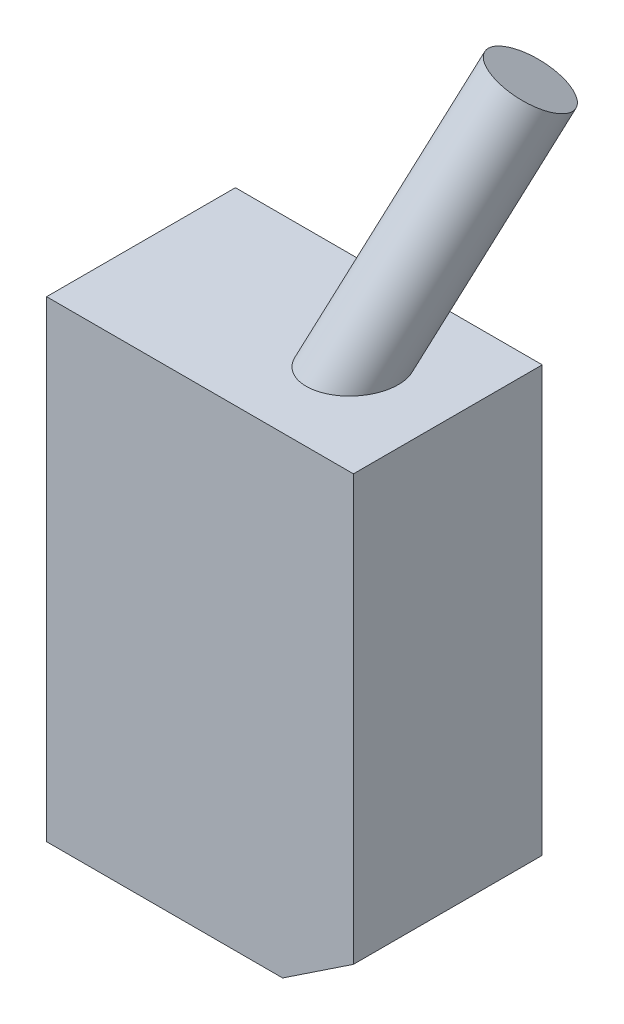
from build123d import *

# Parameters (mm, degrees)
SKETCH1_W                       = 165.1
SKETCH1_H                       = 101.6
BOSS_EXTRUDE1_DEPTH             = 254
CUT_EXTRUDE1_DEPTH              = 254
SKETCH5_R                       = 20.447
BOSS_EXTRUDE3_DEPTH             = 139.7
BOSS_EXTRUDE3_DIRECTION_2_REACH = 285.127


with BuildPart() as part:
    # Sketch1 → Boss-Extrude1 (new body)
    with BuildSketch(Plane(origin=(0, 0, 0), x_dir=(1, 0, 0), z_dir=(0, 1, 0))):
        Rectangle(SKETCH1_W, SKETCH1_H)
    extrude(amount=BOSS_EXTRUDE1_DEPTH)

    # Sketch2 → Cut-Extrude1 (cut)
    with BuildSketch(Plane(origin=(0, 0, -50.8), x_dir=(-1, 0, 0), z_dir=(0, 0, -1))):
        Polygon((-44.45, 0), (-82.55, 25.4), (-82.55, 0), align=None)
    extrude(amount=-CUT_EXTRUDE1_DEPTH, mode=Mode.SUBTRACT)

    # Sketch5 → Boss-Extrude3 (add)
    with BuildSketch(Plane(origin=(31.75, 254, 0), x_dir=(0.9657919899307167, -0.2399824072752947, 0.09825617733263003), z_dir=(0.2588190451025181, 0.8685657757104482, -0.422618261740697))):
        Circle(SKETCH5_R)
    extrude(amount=BOSS_EXTRUDE3_DEPTH)

    # Boss-Extrude3 direction 2: up to this face of the body (flat: up to its plane)
    boss_extrude3_direction_2_end = Plane(part.part.faces().sort_by_distance((0, 254, 0))[0])
    # Sketch5 → Boss-Extrude3 direction 2 (add, up to the picked face)
    with BuildSketch(Plane(origin=(31.75, 254, 0), x_dir=(0.9657919899307167, -0.2399824072752947, 0.09825617733263003), z_dir=(0.2588190451025181, 0.8685657757104482, -0.422618261740697)), mode=Mode.PRIVATE) as boss_extrude3_direction_2_sk1:
        Circle(SKETCH5_R)
    boss_extrude3_direction_2_tool1 = split(extrude(boss_extrude3_direction_2_sk1.sketch, amount=-BOSS_EXTRUDE3_DIRECTION_2_REACH, mode=Mode.PRIVATE), bisect_by=boss_extrude3_direction_2_end, keep=Keep.BOTH, mode=Mode.PRIVATE)
    add(boss_extrude3_direction_2_tool1.solids().sort_by(Axis((31.75, 254, 0), (-0.2588190451025181, -0.8685657757104482, 0.422618261740697)))[0])


solid = part.part
